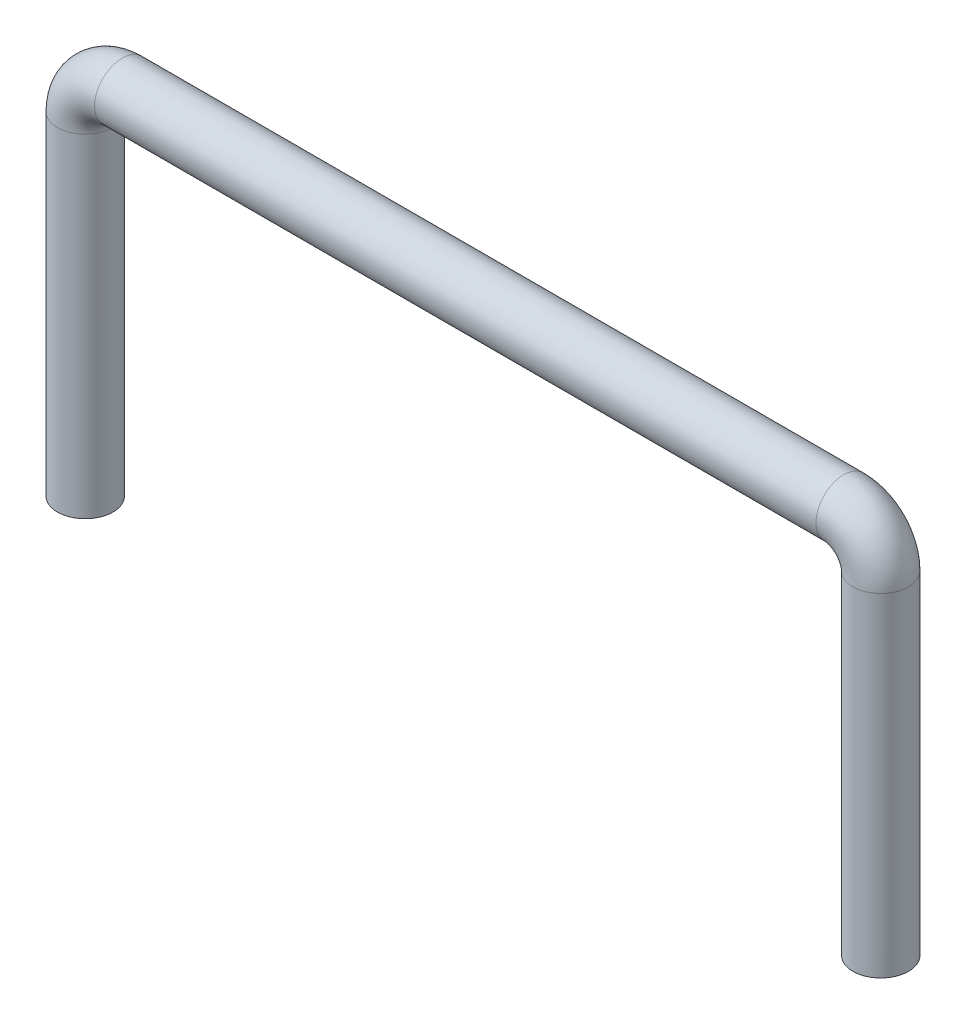
from build123d import *

# Parameters (mm, degrees)
SKETCH2_R = 7.5


with BuildPart() as part:
    # Sweep1: sweep along a path in Sketch1
    with BuildLine(Plane.XY) as sweep1_path:
        Line((-130.416139423, 0), (-130.416139423, 90))
        ThreePointArc((-130.416139423, 90), (-127.487207235, 97.071067812), (-120.416139423, 100))
        Line((-120.416139423, 100), (74.583860577, 100))
        ThreePointArc((74.583860577, 100), (81.654928388, 97.071067812), (84.583860577, 90))
        Line((84.583860577, 90), (84.583860577, 0))
    # Sketch2 → Sweep1 (sweep)
    with BuildSketch(Plane(origin=(0, 0, 0), x_dir=(1, 0, 0), z_dir=(0, 1, 0))):
        with Locations((-130.416139423, 0)):
            Circle(SKETCH2_R)
    sweep(path=sweep1_path.line)


solid = part.part
